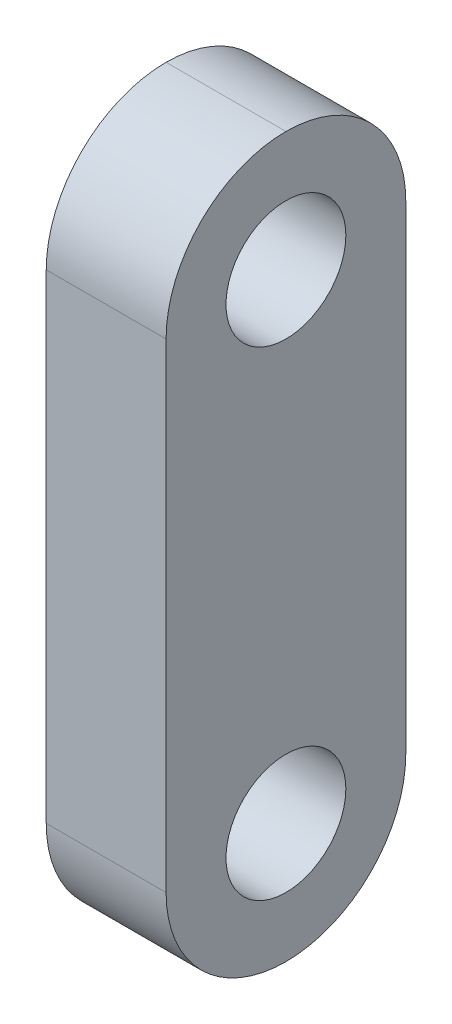
from build123d import *

# Parameters (mm, degrees)
BOSS_EXTRUDE1_DEPTH      = 1.5875
BOSS_EXTRUDE1_DEPTH_BACK = 1.5875
SKETCH1_W                = 6.35
SKETCH1_H                = 19.05
SKETCH1_R                = 1.5875
FILLET1_R                = 3.175


with BuildPart() as part:
    # Sketch1 → Boss-Extrude1 (new, two sides: drawn at the far end of the back side and taken through both)
    with BuildSketch(Plane(origin=(0, 0, 0), x_dir=(0, 0, -1), z_dir=(1, 0, 0)).offset(-BOSS_EXTRUDE1_DEPTH_BACK)):
        with Locations((0, -6.35)):
            Rectangle(SKETCH1_W, SKETCH1_H)
        Circle(SKETCH1_R, mode=Mode.SUBTRACT)
        with Locations((0, -12.7)):
            Circle(SKETCH1_R, mode=Mode.SUBTRACT)
    extrude(amount=BOSS_EXTRUDE1_DEPTH + BOSS_EXTRUDE1_DEPTH_BACK)

    # Fillet1
    fillet1_edges = [part.edges().sort_by_distance(p)[0] for p in [
        (0, -15.875, -3.175),
        (0, -15.875, 3.175),
        (0, 3.175, -3.175),
        (0, 3.175, 3.175),
    ]]
    fillet(fillet1_edges, radius=FILLET1_R - 0.0001)  # a hair under: the kernel refuses the full size


solid = part.part
